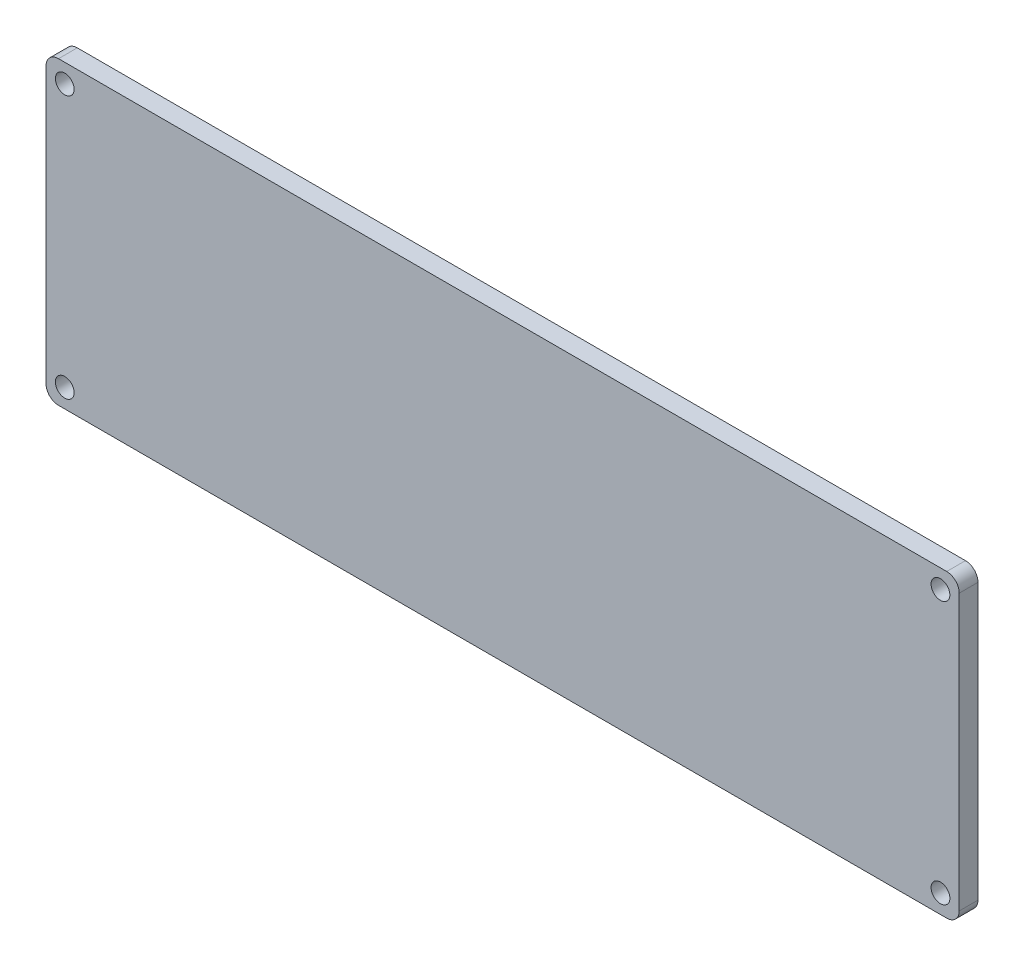
from build123d import *

# Parameters (mm, degrees)
SKETCH1_W           = 146
SKETCH1_H           = 48
SKETCH1_R           = 1.5
BOSS_EXTRUDE1_DEPTH = 3
FILLET1_R           = 2


with BuildPart() as part:
    # Sketch1 → Boss-Extrude1 (new body)
    with BuildSketch(Plane.XY):
        with Locations((73, 24)):
            Rectangle(SKETCH1_W, SKETCH1_H)
        with Locations((143, 45)):
            Circle(SKETCH1_R, mode=Mode.SUBTRACT)
        with Locations((143, 3)):
            Circle(SKETCH1_R, mode=Mode.SUBTRACT)
        with Locations((3, 3)):
            Circle(SKETCH1_R, mode=Mode.SUBTRACT)
        with Locations((3, 45)):
            Circle(SKETCH1_R, mode=Mode.SUBTRACT)
    extrude(amount=BOSS_EXTRUDE1_DEPTH)

    # Fillet1
    fillet1_edges = [part.edges().sort_by_distance(p)[0] for p in [
        (0, 0, 1.5),
        (146, 0, 1.5),
        (146, 48, 1.5),
        (0, 48, 1.5),
    ]]
    fillet(fillet1_edges, radius=FILLET1_R)


solid = part.part
